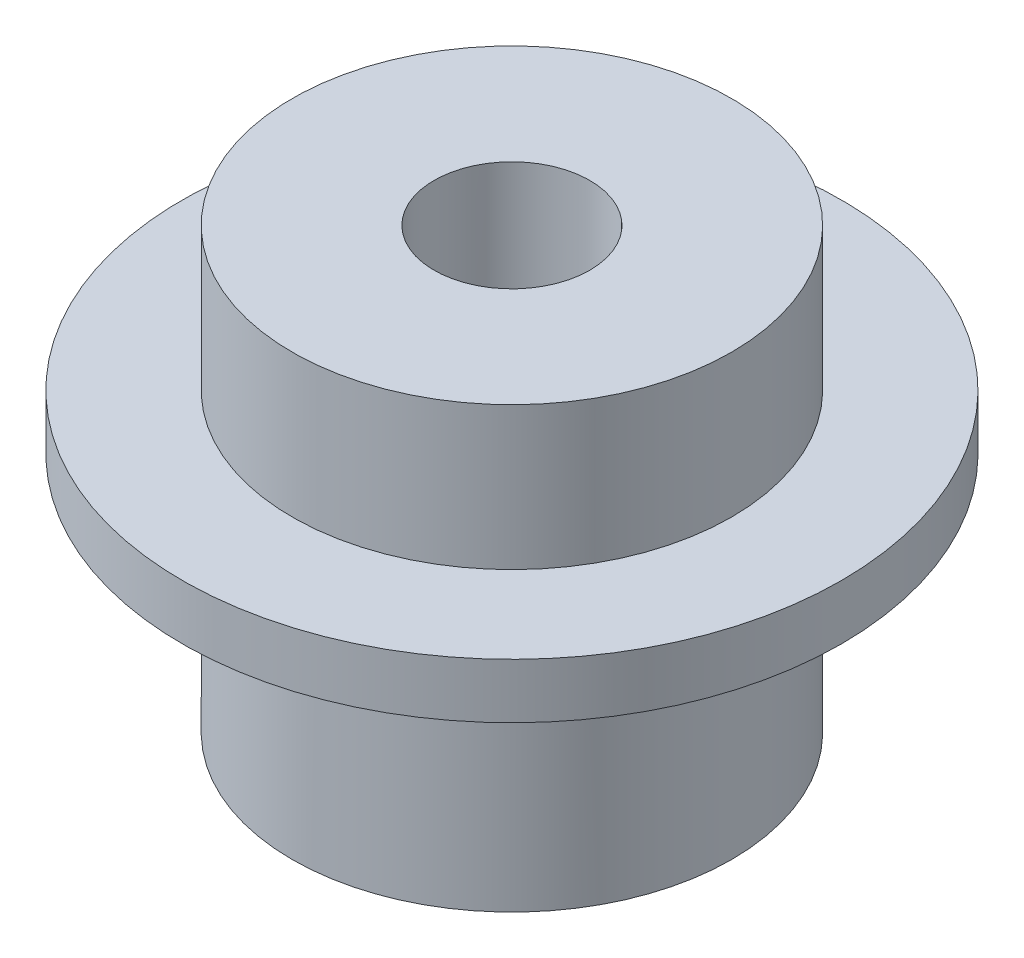
from build123d import *

# Parameters (mm, degrees)
CUT_EXTRUDE1_START = -21.336
SKETCH3_R          = 9.525
CUT_EXTRUDE1_DEPTH = 21.336


with BuildPart() as part:
    # Sketch2 → Revolve2 (revolve)
    with BuildSketch(Plane(origin=(0, 0, 0), x_dir=(0, 1, 0), z_dir=(0, 0, 1))):
        Polygon((12.7, 2.25), (12.7, 6.35), (8.5725, 6.35), (8.5725, 9.525), (6.985, 9.525), (6.985, 6.35), (-6.985, 6.35), (-6.985, 9.525), (-8.5725, 9.525), (-8.5725, 6.35), (-12.7, 6.35), (-12.7, 2.25), align=None)
    revolve(axis=Axis((0, -12.7, 0), (0, 1, 0)))

    # Sketch3 → Cut-Extrude1 (cut)
    with BuildSketch(Plane(origin=(0, 0, 0), x_dir=(-1, 0, 0), z_dir=(0, 1, 0)).offset(CUT_EXTRUDE1_START)):
        Circle(SKETCH3_R)
    extrude(amount=CUT_EXTRUDE1_DEPTH, mode=Mode.SUBTRACT)


solid = part.part
